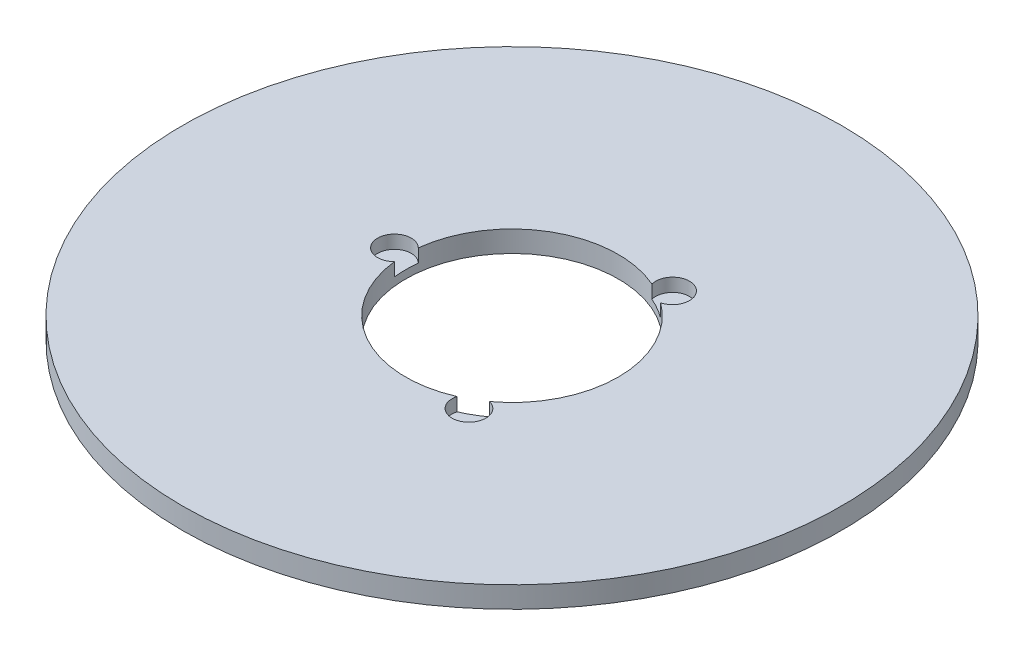
from build123d import *

# Parameters (mm, degrees)
SKETCH1_R           = 77.5
BOSS_EXTRUDE1_DEPTH = 5
SKETCH2_R           = 25
CUT_EXTRUDE1_DEPTH  = 110.715541287
SKETCH3_R           = 3.968254724
CUT_EXTRUDE2_DEPTH  = 3.112564657
CIRPATTERN1_COUNT   = 3


with BuildPart() as part:
    # Sketch1 → Boss-Extrude1 (new body)
    with BuildSketch(Plane(origin=(0, 0, 0), x_dir=(1, 0, 0), z_dir=(0, 1, 0))):
        Circle(SKETCH1_R)
    extrude(amount=BOSS_EXTRUDE1_DEPTH)

    # Sketch2 → Cut-Extrude1 (cut, through all)
    with BuildSketch(Plane(origin=(0, 0, 0), x_dir=(1, 0, 0), z_dir=(0, 1, 0))):
        Circle(SKETCH2_R)
    extrude(amount=CUT_EXTRUDE1_DEPTH, mode=Mode.SUBTRACT)

    # Sketch3 → Cut-Extrude2 (cut)
    with BuildSketch(Plane(origin=(0, 5, 0), x_dir=(1, 0, 0), z_dir=(0, 1, 0))):
        with Locations((-27.646316823, 0)):
            Circle(SKETCH3_R)
    cut_extrude2 = extrude(amount=-CUT_EXTRUDE2_DEPTH, mode=Mode.SUBTRACT)

    # CirPattern1: Cut-Extrude2 ×3 about axis
    cirpattern1_axis = Axis((0, 0, 0), (0, 1, 0))
    for i in range(1, CIRPATTERN1_COUNT):
        add(cut_extrude2.rotate(cirpattern1_axis, i * 360 / CIRPATTERN1_COUNT), mode=Mode.SUBTRACT)


solid = part.part
